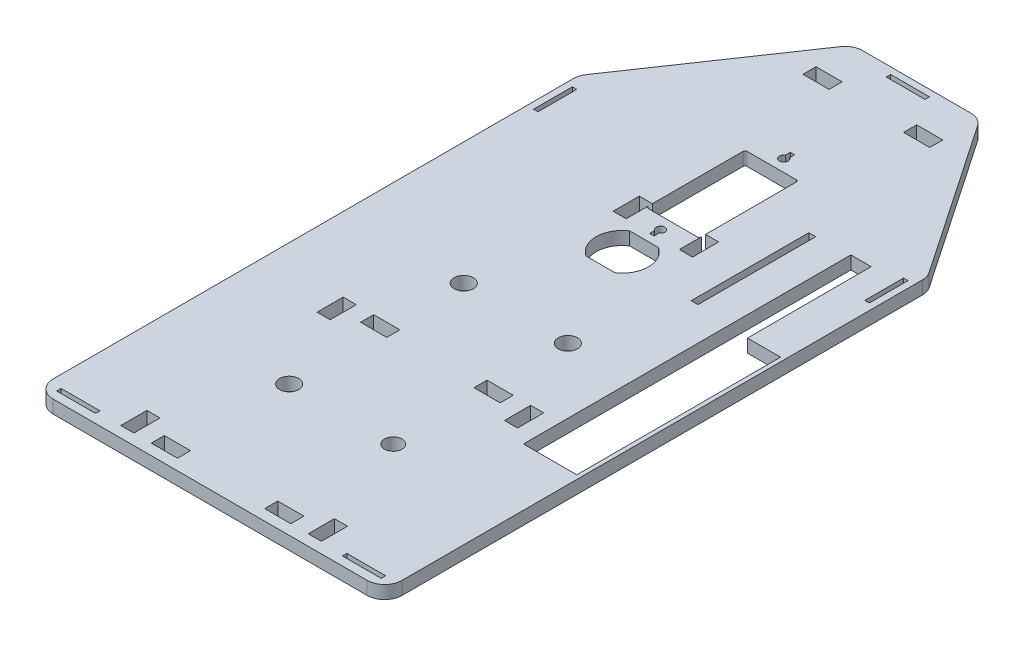
from build123d import *

# Parameters (mm, degrees)
BOSS_EXTRUDE5_OUTLINE_W   = 80
BOSS_EXTRUDE5_OUTLINE_H   = 162
BOSS_EXTRUDE5_OUTLINE_W_2 = 1.57
BOSS_EXTRUDE5_OUTLINE_H_2 = 27
BOSS_EXTRUDE5_DEPTH       = 3
SKETCH8_R                 = 2.2
SKETCH8_R_2               = 2.02
CUT_EXTRUDE1_DEPTH        = 10
CUT_EXTRUDE2_DEPTH        = 10
CUT_EXTRUDE2_DEPTH_BACK   = 3
SKETCH9_W                 = 3
SKETCH9_H                 = 6
SKETCH9_W_2               = 6
SKETCH9_H_2               = 3
SKETCH9_W_3               = 1.02
SKETCH9_H_3               = 8.89
SKETCH9_W_4               = 8.89
SKETCH9_H_4               = 1.02
SKETCH9_W_5               = 4.655263111
SKETCH9_H_5               = 28.36
FILLET3_R                 = 4


# Read off the part's stored shape, not the designer's step: Boss-Extrude5
with BuildPart() as part:
    # Boss-Extrude5 outline → Boss-Extrude5 (new body)
    with BuildSketch(Plane(origin=(0, 0, 0), x_dir=(1, 0, 0), z_dir=(0, 1, 0))):
        with Locations((-31.485263111, -108.03530565)):
            Rectangle(BOSS_EXTRUDE5_OUTLINE_W, BOSS_EXTRUDE5_OUTLINE_H)
        with BuildLine():
            Line((-34.801887901, -89.53530565), (-28.16863832, -89.53530565))
            ThreePointArc((-28.16863832, -89.53530565), (-25.485263111, -94.53530565), (-28.16863832, -99.53530565))
            Line((-28.16863832, -99.53530565), (-34.801887901, -99.53530565))
            ThreePointArc((-34.801887901, -99.53530565), (-37.485263111, -94.53530565), (-34.801887901, -89.53530565))
        make_face(mode=Mode.SUBTRACT)
        with BuildLine():
            Line((-30.985263111, -86.621331054), (-30.985263111, -87.75530565))
            Line((-30.985263111, -87.75530565), (-31.985263111, -87.75530565))
            Line((-31.985263111, -87.75530565), (-31.985263111, -86.621331054))
            ThreePointArc((-31.985263111, -86.621331054), (-31.485263111, -84.75530565), (-30.985263111, -86.621331054))
        make_face(mode=Mode.SUBTRACT)
        with BuildLine():
            Line((-25.885263111, -82.98030565), (-37.085263111, -82.98030565))
            ThreePointArc((-37.085263111, -82.98030565), (-37.438816501, -82.833859041), (-37.585263111, -82.48030565))
            Line((-37.585263111, -82.48030565), (-37.585263111, -60.78030565))
            ThreePointArc((-37.585263111, -60.78030565), (-37.438816502, -60.42675226), (-37.085263111, -60.28030565))
            Line((-37.085263111, -60.28030565), (-25.885263111, -60.28030565))
            ThreePointArc((-25.885263111, -60.28030565), (-25.53170972, -60.426752259), (-25.385263111, -60.78030565))
            Line((-25.385263111, -60.78030565), (-25.385263111, -82.48030565))
            ThreePointArc((-25.385263111, -82.48030565), (-25.53170972, -82.833859041), (-25.885263111, -82.98030565))
        make_face(mode=Mode.SUBTRACT)
        with Locations((-13.090263111, -82.857662255)):
            Rectangle(BOSS_EXTRUDE5_OUTLINE_W_2, BOSS_EXTRUDE5_OUTLINE_H_2, mode=Mode.SUBTRACT)
        with BuildLine():
            ThreePointArc((-30.985263111, -56.639280246), (-31.485263111, -58.50530565), (-31.985263111, -56.639280246))
            Line((-31.985263111, -56.639280246), (-31.985263111, -55.50530565))
            Line((-31.985263111, -55.50530565), (-30.985263111, -55.50530565))
            Line((-30.985263111, -55.50530565), (-30.985263111, -56.639280246))
        make_face(mode=Mode.SUBTRACT)
    extrude(amount=BOSS_EXTRUDE5_DEPTH)

    # Sketch8 → Cut-Extrude1 (cut)
    with BuildSketch(Plane(origin=(0, 3, 0), x_dir=(1, 0, 0), z_dir=(0, 1, 0))):
        with Locations(Location((-43.415263111, -118.95530565, 0), (0, 0, 270))):
            Circle(SKETCH8_R)
        with Locations(Location((-19.555263111, -118.95530565, 0), (0, 0, 270))):
            Circle(SKETCH8_R)
        with Locations(Location((-19.555263111, -158.99530565, 0), (0, 0, 270))):
            Circle(SKETCH8_R_2)
        with Locations(Location((-43.415263111, -158.99530565, 0), (0, 0, 270))):
            Circle(SKETCH8_R)
    extrude(amount=-CUT_EXTRUDE1_DEPTH, mode=Mode.SUBTRACT)

    # Sketch9 → Cut-Extrude2 (cut, two sides: drawn at the far end of the back side and taken through both)
    with BuildSketch(Plane(origin=(0, 3, 0), x_dir=(1, 0, 0), z_dir=(0, 1, 0)).offset(-CUT_EXTRUDE2_DEPTH_BACK)):
        with Locations((-52.985263111, -183.53530565)):
            Rectangle(SKETCH9_W, SKETCH9_H)
        with Locations((-9.985263111, -183.53530565)):
            Rectangle(SKETCH9_W, SKETCH9_H)
        with Locations((-9.985263111, -138.53530565)):
            Rectangle(SKETCH9_W, SKETCH9_H)
        with Locations((-52.985263111, -138.53530565)):
            Rectangle(SKETCH9_W, SKETCH9_H)
        Polygon((-37.585263111, -81.53530565), (-40.585263111, -81.53530565), (-40.585263111, -87.53530565), (-37.585263111, -87.53530565), (-37.585263111, -82.48030565), align=None)
        Polygon((-25.385263111, -87.53530565), (-22.385263111, -87.53530565), (-22.385263111, -81.53530565), (-25.385263111, -81.53530565), (-25.385263111, -82.48030565), align=None)
        with Locations((-44.485263111, -185.03530565)):
            Rectangle(SKETCH9_W_2, SKETCH9_H_2)
        with Locations((-18.485263111, -185.03530565)):
            Rectangle(SKETCH9_W_2, SKETCH9_H_2)
        with Locations((-44.485263111, -137.03530565)):
            Rectangle(SKETCH9_W_2, SKETCH9_H_2)
        with Locations((-18.485263111, -137.03530565)):
            Rectangle(SKETCH9_W_2, SKETCH9_H_2)
        with Locations((-69.465263111, -71.94030565)):
            Rectangle(SKETCH9_W_3, SKETCH9_H_3)
        with Locations((-31.485263111, -29.05530565)):
            Rectangle(SKETCH9_W_4, SKETCH9_H_4)
        with Locations((6.494736889, -71.94030565)):
            Rectangle(SKETCH9_W_3, SKETCH9_H_3)
        with Locations((-64.240263111, -186.51530565)):
            Rectangle(SKETCH9_W_4, SKETCH9_H_4)
        with Locations((1.269736889, -186.51530565)):
            Rectangle(SKETCH9_W_4, SKETCH9_H_4)
        Polygon((0, -97.31530565), (-4.655263111, -97.31530565), (-4.655263111, -144.03530565), (7.584736889, -144.03530565), (7.584736889, -97.31530565), align=None)
        with Locations((-2.327631556, -83.13530565)):
            Rectangle(SKETCH9_W_5, SKETCH9_H_5)
        with Locations((-43.025263111, -37.07530565)):
            Rectangle(SKETCH9_W_2, SKETCH9_H_2)
        with Locations((-19.945263111, -37.07530565)):
            Rectangle(SKETCH9_W_2, SKETCH9_H_2)
        Polygon((-16.945263111, -27.03530565), (8.514736889, -64.49530565), (8.514736889, -27.03530565), align=None)
        Polygon((-71.485263111, -27.03530565), (-71.485263111, -64.49530565), (-46.025263111, -27.03530565), align=None)
    extrude(amount=CUT_EXTRUDE2_DEPTH + CUT_EXTRUDE2_DEPTH_BACK, mode=Mode.SUBTRACT)

    # Fillet3
    fillet3_edges = [part.edges().sort_by_distance(p)[0] for p in [
        (-16.945263111, 1.5, 27.03530565),
        (8.514736889, 1.5, 64.49530565),
        (-71.485263111, 1.5, 64.49530565),
        (-46.025263111, 1.5, 27.03530565),
        (-71.485263111, 1.5, 189.03530565),
        (8.514736889, 1.5, 189.03530565),
    ]]
    fillet(fillet3_edges, radius=FILLET3_R)


solid = part.part
